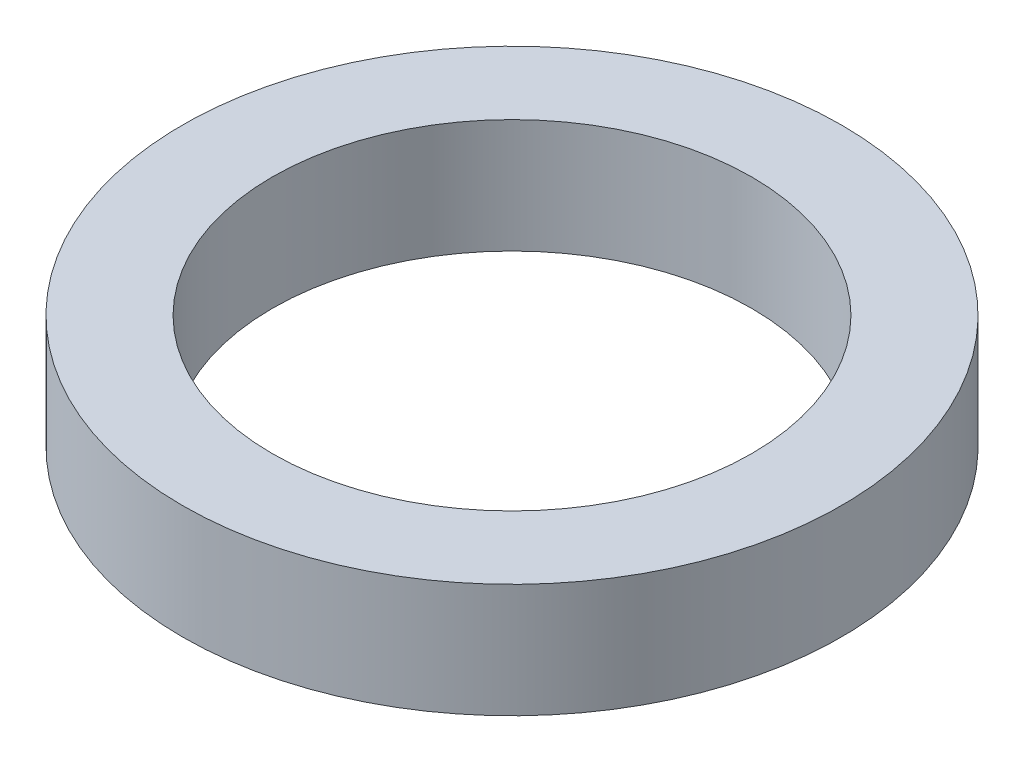
from build123d import *

# Parameters (mm, degrees)
SKETCH1_R           = 55
BOSS_EXTRUDE1_DEPTH = 19
SKETCH2_R           = 40
CUT_EXTRUDE1_DEPTH  = 81.068720484


with BuildPart() as part:
    # Sketch1 → Boss-Extrude1 (new body)
    with BuildSketch(Plane(origin=(0, 0, 0), x_dir=(1, 0, 0), z_dir=(0, 1, 0))):
        Circle(SKETCH1_R)
    extrude(amount=BOSS_EXTRUDE1_DEPTH)

    # Sketch2 → Cut-Extrude1 (cut, through all)
    with BuildSketch(Plane(origin=(0, 0, 0), x_dir=(1, 0, 0), z_dir=(0, 1, 0))):
        Circle(SKETCH2_R)
    extrude(amount=CUT_EXTRUDE1_DEPTH, mode=Mode.SUBTRACT)


solid = part.part
